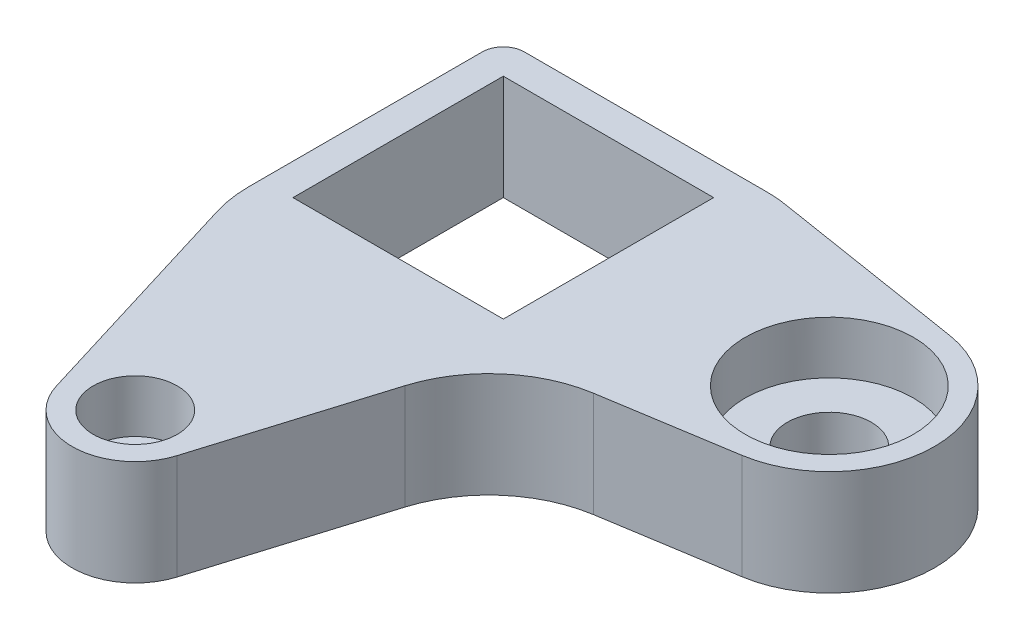
from build123d import *

# Parameters (mm, degrees)
SKETCH1_W           = 20
SKETCH1_H           = 20
BOSS_EXTRUDE1_DEPTH = 10
SKETCH2_R           = 4
SKETCH2_R_2         = 8
CUT_EXTRUDE2_DEPTH  = 46
SKETCH3_R           = 4
CUT_EXTRUDE4_DEPTH  = 36


with BuildPart() as part:
    # Sketch1 → Boss-Extrude1 (new body)
    with BuildSketch(Plane(origin=(0, 0, 0), x_dir=(1, 0, 0), z_dir=(0, 1, 0))):
        with BuildLine():
            Line((23.939871077, 2.849965846), (42.576368333, -0.125028462))
            ThreePointArc((42.576368333, -0.125028462), (51, -10), (42.576368333, -19.874971538))
            Line((42.576368333, -19.874971538), (30.394725659, -21.819560004))
            ThreePointArc((30.394725659, -21.819560004), (24.408108439, -24.617839175), (20.810680125, -30.161165034))
            Line((20.810680125, -30.161165034), (15.737843767, -46.754180408))
            ThreePointArc((15.737843767, -46.754180408), (10, -51), (4.262156233, -46.754180408))
            Line((4.262156233, -46.754180408), (-2.475687534, -24.71500206))
            ThreePointArc((-2.475687534, -24.71500206), (-2.868198061, -22.980302653), (-3, -21.206641244))
            Line((-3, -21.206641244), (-3, 1))
            ThreePointArc((-3, 1), (-2.414213562, 2.414213562), (-1, 3))
            Line((-1, 3), (22.048229077, 3))
            ThreePointArc((22.048229077, 3), (22.997020375, 2.962432657), (23.939871077, 2.849965846))
        make_face()
        with Locations((10, -10)):
            Rectangle(SKETCH1_W, SKETCH1_H, mode=Mode.SUBTRACT)
    extrude(amount=BOSS_EXTRUDE1_DEPTH)

    # Sketch2 → Cut-Extrude2 (cut)
    with BuildSketch(Plane(origin=(0, 5, 0), x_dir=(1, 0, 0), z_dir=(0, 1, 0))):
        with Locations((10, -45)):
            Circle(SKETCH2_R)
        with Locations((41, -10)):
            Circle(SKETCH2_R_2)
    extrude(amount=CUT_EXTRUDE2_DEPTH, mode=Mode.SUBTRACT)

    # Sketch3 → Cut-Extrude4 (cut)
    with BuildSketch(Plane(origin=(0, 5, -5), x_dir=(1, 0, 0), z_dir=(0, -1, 0))):
        with Locations((41, 15)):
            Circle(SKETCH3_R)
    extrude(amount=CUT_EXTRUDE4_DEPTH, mode=Mode.SUBTRACT)


solid = part.part
